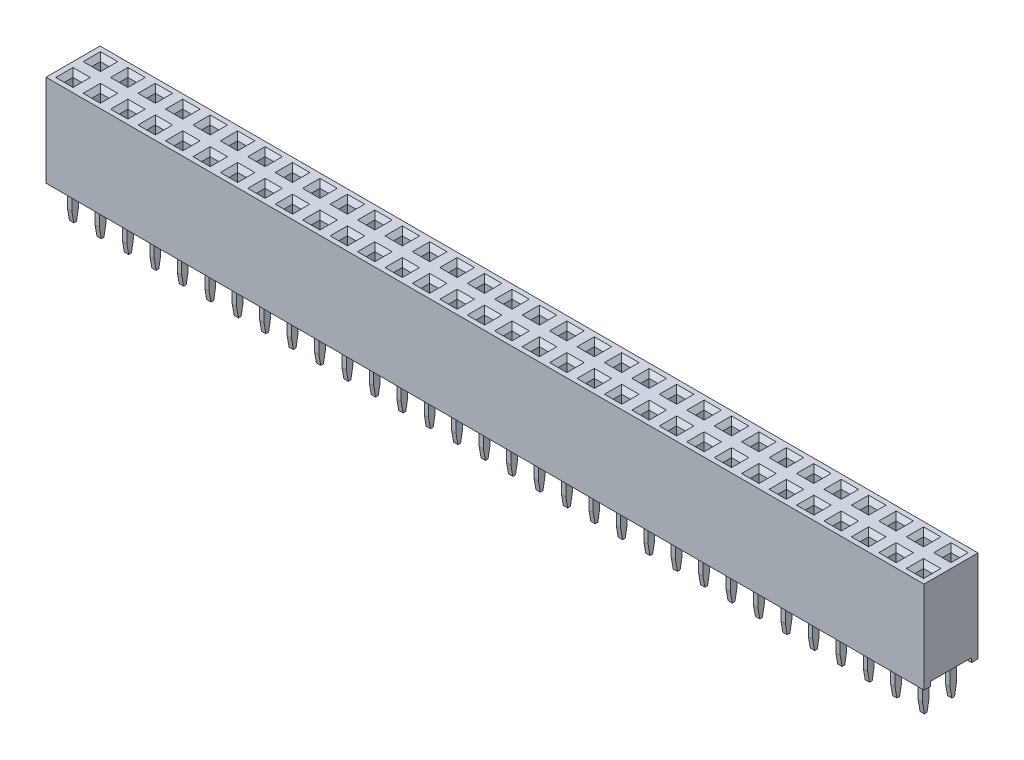
from build123d import *

# Parameters (mm, degrees)
EXTRUDE_1_DEPTH        = 1.27
EXTRUDE_2_DEPTH        = 0.2
SKETCH_3_W             = 0.8
SKETCH_3_H             = 0.8
CUT_EXTRUDE_1_DEPTH    = 7
CHAMFER_1_SIZE         = 0.4
PATTERN_LINEAR_1_COUNT = 32
PATTERN_LINEAR_1_PITCH = 2.54


with BuildPart() as part:
    # Эскиз1 → Бобышка-Вытянуть1 (new, symmetric)
    with BuildSketch(Plane(origin=(0, 0, 0), x_dir=(0, 0, -1), z_dir=(1, 0, 0))):
        Polygon((0, 0.4), (1.9, 0.4), (1.9, 0), (2.5, 0), (2.5, 8.5), (0, 8.5), align=None)
    extrude(amount=EXTRUDE_1_DEPTH, both=True)

    # Эскиз2 → Бобышка-Вытянуть2 (add, symmetric)
    with BuildSketch(Plane(origin=(0, 0, 0), x_dir=(0, 0, -1), z_dir=(1, 0, 0))):
        Polygon((0.97, 0.4), (0.97, -2), (1.146326981, -3), (1.393673019, -3), (1.57, -2), (1.57, 0.4), align=None)
    extrude(amount=EXTRUDE_2_DEPTH, both=True)

    # Эскиз3 → Вырез-Вытянуть1 (cut)
    with BuildSketch(Plane(origin=(0, 8.5, 0), x_dir=(1, 0, 0), z_dir=(0, 1, 0))):
        with Locations((0, 1.27)):
            Rectangle(SKETCH_3_W, SKETCH_3_H)
    extrude(amount=-CUT_EXTRUDE_1_DEPTH, mode=Mode.SUBTRACT)

    # Фаска1
    chamfer_1_edges = [part.edges().sort_by_distance(p)[0] for p in [
        (0.4, 8.5, -1.27),
        (0, 8.5, -0.87),
        (0, 8.5, -1.67),
        (-0.4, 8.5, -1.27),
    ]]
    chamfer(chamfer_1_edges, length=CHAMFER_1_SIZE)

    # Зеркальное отражение1: part across plane


with BuildPart() as part_1:
    add(part.part)
    add(part.part.mirror(Plane(origin=(1.27, 8.5, 0), x_dir=(1, 0, 0), z_dir=(0, 0, -1))))


with BuildPart() as pattern_linear_1_1:
    # Линейный массив1: pattern copy
    add(part_1.part.moved(Location(Vector(1, 0, 0) * (1 * PATTERN_LINEAR_1_PITCH))))


with BuildPart() as pattern_linear_1_2:
    # Линейный массив1: pattern copy
    add(part_1.part.moved(Location(Vector(1, 0, 0) * (2 * PATTERN_LINEAR_1_PITCH))))


with BuildPart() as pattern_linear_1_3:
    # Линейный массив1: pattern copy
    add(part_1.part.moved(Location(Vector(1, 0, 0) * (3 * PATTERN_LINEAR_1_PITCH))))


with BuildPart() as pattern_linear_1_4:
    # Линейный массив1: pattern copy
    add(part_1.part.moved(Location(Vector(1, 0, 0) * (4 * PATTERN_LINEAR_1_PITCH))))


with BuildPart() as pattern_linear_1_5:
    # Линейный массив1: pattern copy
    add(part_1.part.moved(Location(Vector(1, 0, 0) * (5 * PATTERN_LINEAR_1_PITCH))))


with BuildPart() as pattern_linear_1_6:
    # Линейный массив1: pattern copy
    add(part_1.part.moved(Location(Vector(1, 0, 0) * (6 * PATTERN_LINEAR_1_PITCH))))


with BuildPart() as pattern_linear_1_7:
    # Линейный массив1: pattern copy
    add(part_1.part.moved(Location(Vector(1, 0, 0) * (7 * PATTERN_LINEAR_1_PITCH))))


with BuildPart() as pattern_linear_1_8:
    # Линейный массив1: pattern copy
    add(part_1.part.moved(Location(Vector(1, 0, 0) * (8 * PATTERN_LINEAR_1_PITCH))))


with BuildPart() as pattern_linear_1_9:
    # Линейный массив1: pattern copy
    add(part_1.part.moved(Location(Vector(1, 0, 0) * (9 * PATTERN_LINEAR_1_PITCH))))


with BuildPart() as pattern_linear_1_10:
    # Линейный массив1: pattern copy
    add(part_1.part.moved(Location(Vector(1, 0, 0) * (10 * PATTERN_LINEAR_1_PITCH))))


with BuildPart() as pattern_linear_1_11:
    # Линейный массив1: pattern copy
    add(part_1.part.moved(Location(Vector(1, 0, 0) * (11 * PATTERN_LINEAR_1_PITCH))))


with BuildPart() as pattern_linear_1_12:
    # Линейный массив1: pattern copy
    add(part_1.part.moved(Location(Vector(1, 0, 0) * (12 * PATTERN_LINEAR_1_PITCH))))


with BuildPart() as pattern_linear_1_13:
    # Линейный массив1: pattern copy
    add(part_1.part.moved(Location(Vector(1, 0, 0) * (13 * PATTERN_LINEAR_1_PITCH))))


with BuildPart() as pattern_linear_1_14:
    # Линейный массив1: pattern copy
    add(part_1.part.moved(Location(Vector(1, 0, 0) * (14 * PATTERN_LINEAR_1_PITCH))))


with BuildPart() as pattern_linear_1_15:
    # Линейный массив1: pattern copy
    add(part_1.part.moved(Location(Vector(1, 0, 0) * (15 * PATTERN_LINEAR_1_PITCH))))


with BuildPart() as pattern_linear_1_16:
    # Линейный массив1: pattern copy
    add(part_1.part.moved(Location(Vector(1, 0, 0) * (16 * PATTERN_LINEAR_1_PITCH))))


with BuildPart() as pattern_linear_1_17:
    # Линейный массив1: pattern copy
    add(part_1.part.moved(Location(Vector(1, 0, 0) * (17 * PATTERN_LINEAR_1_PITCH))))


with BuildPart() as pattern_linear_1_18:
    # Линейный массив1: pattern copy
    add(part_1.part.moved(Location(Vector(1, 0, 0) * (18 * PATTERN_LINEAR_1_PITCH))))


with BuildPart() as pattern_linear_1_19:
    # Линейный массив1: pattern copy
    add(part_1.part.moved(Location(Vector(1, 0, 0) * (19 * PATTERN_LINEAR_1_PITCH))))


with BuildPart() as pattern_linear_1_20:
    # Линейный массив1: pattern copy
    add(part_1.part.moved(Location(Vector(1, 0, 0) * (20 * PATTERN_LINEAR_1_PITCH))))


with BuildPart() as pattern_linear_1_21:
    # Линейный массив1: pattern copy
    add(part_1.part.moved(Location(Vector(1, 0, 0) * (21 * PATTERN_LINEAR_1_PITCH))))


with BuildPart() as pattern_linear_1_22:
    # Линейный массив1: pattern copy
    add(part_1.part.moved(Location(Vector(1, 0, 0) * (22 * PATTERN_LINEAR_1_PITCH))))


with BuildPart() as pattern_linear_1_23:
    # Линейный массив1: pattern copy
    add(part_1.part.moved(Location(Vector(1, 0, 0) * (23 * PATTERN_LINEAR_1_PITCH))))


with BuildPart() as pattern_linear_1_24:
    # Линейный массив1: pattern copy
    add(part_1.part.moved(Location(Vector(1, 0, 0) * (24 * PATTERN_LINEAR_1_PITCH))))


with BuildPart() as pattern_linear_1_25:
    # Линейный массив1: pattern copy
    add(part_1.part.moved(Location(Vector(1, 0, 0) * (25 * PATTERN_LINEAR_1_PITCH))))


with BuildPart() as pattern_linear_1_26:
    # Линейный массив1: pattern copy
    add(part_1.part.moved(Location(Vector(1, 0, 0) * (26 * PATTERN_LINEAR_1_PITCH))))


with BuildPart() as pattern_linear_1_27:
    # Линейный массив1: pattern copy
    add(part_1.part.moved(Location(Vector(1, 0, 0) * (27 * PATTERN_LINEAR_1_PITCH))))


with BuildPart() as pattern_linear_1_28:
    # Линейный массив1: pattern copy
    add(part_1.part.moved(Location(Vector(1, 0, 0) * (28 * PATTERN_LINEAR_1_PITCH))))


with BuildPart() as pattern_linear_1_29:
    # Линейный массив1: pattern copy
    add(part_1.part.moved(Location(Vector(1, 0, 0) * (29 * PATTERN_LINEAR_1_PITCH))))


with BuildPart() as pattern_linear_1_30:
    # Линейный массив1: pattern copy
    add(part_1.part.moved(Location(Vector(1, 0, 0) * (30 * PATTERN_LINEAR_1_PITCH))))


with BuildPart() as pattern_linear_1_31:
    # Линейный массив1: pattern copy
    add(part_1.part.moved(Location(Vector(1, 0, 0) * (31 * PATTERN_LINEAR_1_PITCH))))


with BuildPart() as part_2:
    add(part_1.part)

    # Combine 1: union Линейный массив1_10, Линейный массив1_27, Линейный массив1_5, Линейный массив1_22, Линейный массив1_17, Линейный массив1_12, Линейный массив1_29, Линейный массив1_7, Линейный массив1_24, Линейный массив1_2, Линейный массив1_19, Линейный массив1_14, Линейный массив1_31, Линейный массив1_9, Линейный массив1_26, Линейный массив1_4, Линейный массив1_21, Линейный массив1_16, Линейный массив1_11, Линейный массив1_28, Линейный массив1_6, Линейный массив1_23, Линейный массив1_1, Линейный массив1_18, Линейный массив1_13, Линейный массив1_30, Линейный массив1_8, Линейный массив1_25, Линейный массив1_3, Линейный массив1_20, Линейный массив1_15
    add(pattern_linear_1_10.part)
    add(pattern_linear_1_27.part)
    add(pattern_linear_1_5.part)
    add(pattern_linear_1_22.part)
    add(pattern_linear_1_17.part)
    add(pattern_linear_1_12.part)
    add(pattern_linear_1_29.part)
    add(pattern_linear_1_7.part)
    add(pattern_linear_1_24.part)
    add(pattern_linear_1_2.part)
    add(pattern_linear_1_19.part)
    add(pattern_linear_1_14.part)
    add(pattern_linear_1_31.part)
    add(pattern_linear_1_9.part)
    add(pattern_linear_1_26.part)
    add(pattern_linear_1_4.part)
    add(pattern_linear_1_21.part)
    add(pattern_linear_1_16.part)
    add(pattern_linear_1_11.part)
    add(pattern_linear_1_28.part)
    add(pattern_linear_1_6.part)
    add(pattern_linear_1_23.part)
    add(pattern_linear_1_1.part)
    add(pattern_linear_1_18.part)
    add(pattern_linear_1_13.part)
    add(pattern_linear_1_30.part)
    add(pattern_linear_1_8.part)
    add(pattern_linear_1_25.part)
    add(pattern_linear_1_3.part)
    add(pattern_linear_1_20.part)
    add(pattern_linear_1_15.part)


solid = part_2.part
